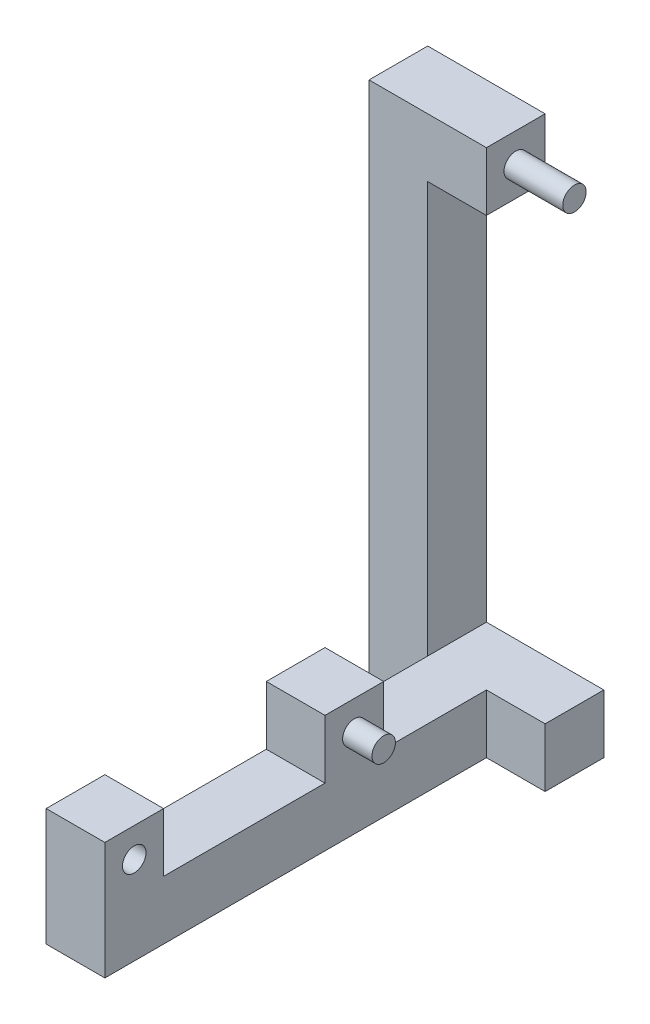
from build123d import *

# Parameters (mm, degrees)
LOWERBASE_W             = 200
LOWERBASE_H             = 200
BOSS_EXTRUDE1_DEPTH     = 200
UPPERBASE_W             = 200
UPPERBASE_H             = 1800
BOSS_EXTRUDE2_DEPTH     = 200
TOPPIVOT_W              = 200
TOPPIVOT_H              = 200
BOSS_EXTRUDE3_DEPTH     = 200
PRESSTABLE_W            = 200
PRESSTABLE_H            = 200
BOSS_EXTRUDE4_DEPTH     = 400
MIDDLERIVET_R           = 40
BOSS_EXTRUDE5_DEPTH     = 300
TOPRIVET_R              = 40
BOSS_EXTRUDE6_DEPTH     = 400
CUT_EXTRUDE1_DEPTH      = 2377.972864801
CUT_EXTRUDE1_DEPTH_BACK = 2377.972864801
SKETCH6_R               = 40


with BuildPart() as part:
    # LowerBase → Boss-Extrude1 (new body)
    with BuildSketch(Plane(origin=(0, 0, 0), x_dir=(0, 0, -1), z_dir=(1, 0, 0))):
        Polygon((-1500, 0), (0, 0), (0, 200), (-550, 200), (-750, 200), (-1300, 200), (-1500, 200), align=None)
        with Locations((-1400, 300)):
            Rectangle(LOWERBASE_W, LOWERBASE_H)
        with Locations((-650, 300)):
            Rectangle(LOWERBASE_W, LOWERBASE_H)
    extrude(amount=BOSS_EXTRUDE1_DEPTH)

    # UpperBase → Boss-Extrude2 (add)
    with BuildSketch(Plane(origin=(0, 0, 0), x_dir=(0, 0, -1), z_dir=(1, 0, 0))):
        with Locations((-100, 900)):
            Rectangle(UPPERBASE_W, UPPERBASE_H)
    extrude(amount=-BOSS_EXTRUDE2_DEPTH)

    # TopPivot → Boss-Extrude3 (add)
    with BuildSketch(Plane(origin=(0, 0, 0), x_dir=(0, 0, -1), z_dir=(1, 0, 0))):
        with Locations((-100, 1700)):
            Rectangle(TOPPIVOT_W, TOPPIVOT_H)
    extrude(amount=BOSS_EXTRUDE3_DEPTH)

    # PressTable → Boss-Extrude4 (add)
    with BuildSketch(Plane(origin=(0, 0, 0), x_dir=(0, 0, -1), z_dir=(1, 0, 0))):
        with Locations((-100, 100)):
            Rectangle(PRESSTABLE_W, PRESSTABLE_H)
    extrude(amount=BOSS_EXTRUDE4_DEPTH)

    # MiddleRivet → Boss-Extrude5 (add)
    with BuildSketch(Plane(origin=(0, 0, 0), x_dir=(0, 0, -1), z_dir=(1, 0, 0))):
        with Locations((-650, 300)):
            Circle(MIDDLERIVET_R)
    extrude(amount=BOSS_EXTRUDE5_DEPTH)

    # Sketch6 → Cut-Extrude1 (cut, two sides: drawn at the far end of the back side and taken through both)
    with BuildSketch(Plane(origin=(0, 0, 0), x_dir=(0, 0, -1), z_dir=(1, 0, 0)).offset(-CUT_EXTRUDE1_DEPTH_BACK)):
        with Locations((-1400, 300)):
            Circle(SKETCH6_R)
    extrude(amount=CUT_EXTRUDE1_DEPTH + CUT_EXTRUDE1_DEPTH_BACK, mode=Mode.SUBTRACT)


with BuildPart() as body_2:
    # TopRivet → Boss-Extrude6 (new body)
    with BuildSketch(Plane(origin=(0, 0, 0), x_dir=(0, 0, -1), z_dir=(1, 0, 0))):
        with Locations((-100, 1700)):
            Circle(TOPRIVET_R)
    extrude(amount=BOSS_EXTRUDE6_DEPTH)


solid = Compound([part.part, body_2.part])
